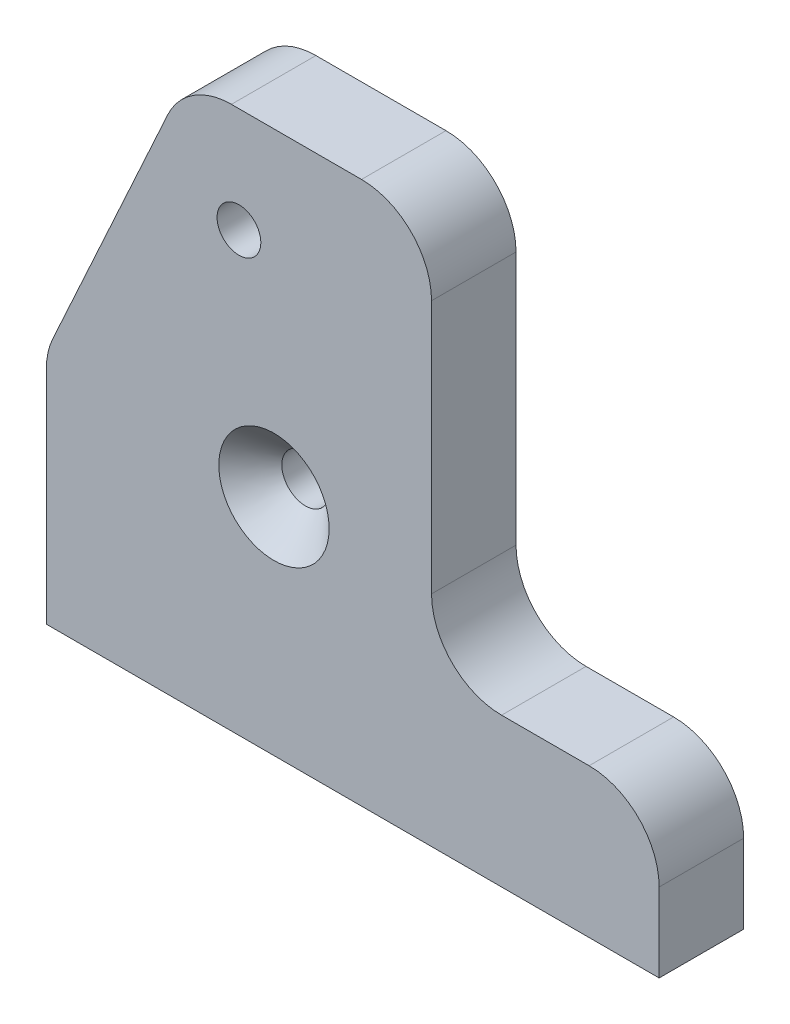
from build123d import *

# Parameters (mm, degrees)
BOSS_EXTRUDE1_DEPTH                             = 4.826
M3X0_5_TAPPED_HOLE2_D                           = 2.5
M3X0_5_TAPPED_HOLE3_D                           = 2.5
M3X0_5_TAPPED_HOLE3_DEPTH                       = 5
M3X0_5_TAPPED_HOLE3_TIP                         = 0.751075774
FILLET2_R                                       = 4
CUT_EXTRUDE1_DEPTH                              = 10
CSK_FOR_M3_FLAT_HEAD_MACHINE_SCREW1_D           = 2.7
CSK_FOR_M3_FLAT_HEAD_MACHINE_SCREW1_CSINK_D     = 6.3
CSK_FOR_M3_FLAT_HEAD_MACHINE_SCREW1_CSINK_ANGLE = 90


with BuildPart() as part:
    # Sketch1 → Boss-Extrude1 (new body)
    with BuildSketch(Plane.XY):
        Polygon((0, 13.5), (0, 0), (35, 0), (35, 8.5), (22, 8.5), (22, 31), (8, 31), align=None)
    extrude(amount=BOSS_EXTRUDE1_DEPTH)

    # M3x0.5 Tapped Hole2 (through all)
    with Locations(Plane.XY.offset(4.826)):
        with Locations((11, 25)):
            Hole(M3X0_5_TAPPED_HOLE2_D / 2)

    # M3x0.5 Tapped Hole3
    with Locations(Plane(origin=(0, 0, 0), x_dir=(-1, 0, 0), z_dir=(0, -1, 0))):
        with Locations((-16.73, -2.413), (-28.73, -2.413)):
            Hole(M3X0_5_TAPPED_HOLE3_D / 2, depth=M3X0_5_TAPPED_HOLE3_DEPTH)
            with Locations((0, 0, -(M3X0_5_TAPPED_HOLE3_DEPTH + M3X0_5_TAPPED_HOLE3_TIP / 2))):  # 118° drill point
                Cone(0, M3X0_5_TAPPED_HOLE3_D / 2, M3X0_5_TAPPED_HOLE3_TIP, mode=Mode.SUBTRACT)

    # Fillet2
    fillet2_edges = [part.edges().sort_by_distance(p)[0] for p in [
        (35, 8.5, 2.413),
        (22, 8.5, 2.413),
        (22, 31, 2.413),
        (0, 13.5, 2.413),
        (8, 31, 2.413),
    ]]
    fillet(fillet2_edges, radius=FILLET2_R)

    # Sketch19 → Cut-Extrude1 (cut)
    with BuildSketch(Plane.XY.offset(4.826)):
        with BuildLine():
            ThreePointArc((11.75, 12.8), (13, 11.55), (14.25, 12.8))
            ThreePointArc((14.25, 12.8), (13, 14.05), (11.75, 12.8))
        make_face()
    extrude(amount=-CUT_EXTRUDE1_DEPTH, mode=Mode.SUBTRACT)

    # CSK for M3 Flat Head Machine Screw1 (through all)
    with Locations(Plane.XY.offset(4.826)):
        with Locations((13, 12.8)):
            CounterSinkHole(CSK_FOR_M3_FLAT_HEAD_MACHINE_SCREW1_D / 2, CSK_FOR_M3_FLAT_HEAD_MACHINE_SCREW1_CSINK_D / 2, counter_sink_angle=CSK_FOR_M3_FLAT_HEAD_MACHINE_SCREW1_CSINK_ANGLE)


solid = part.part
